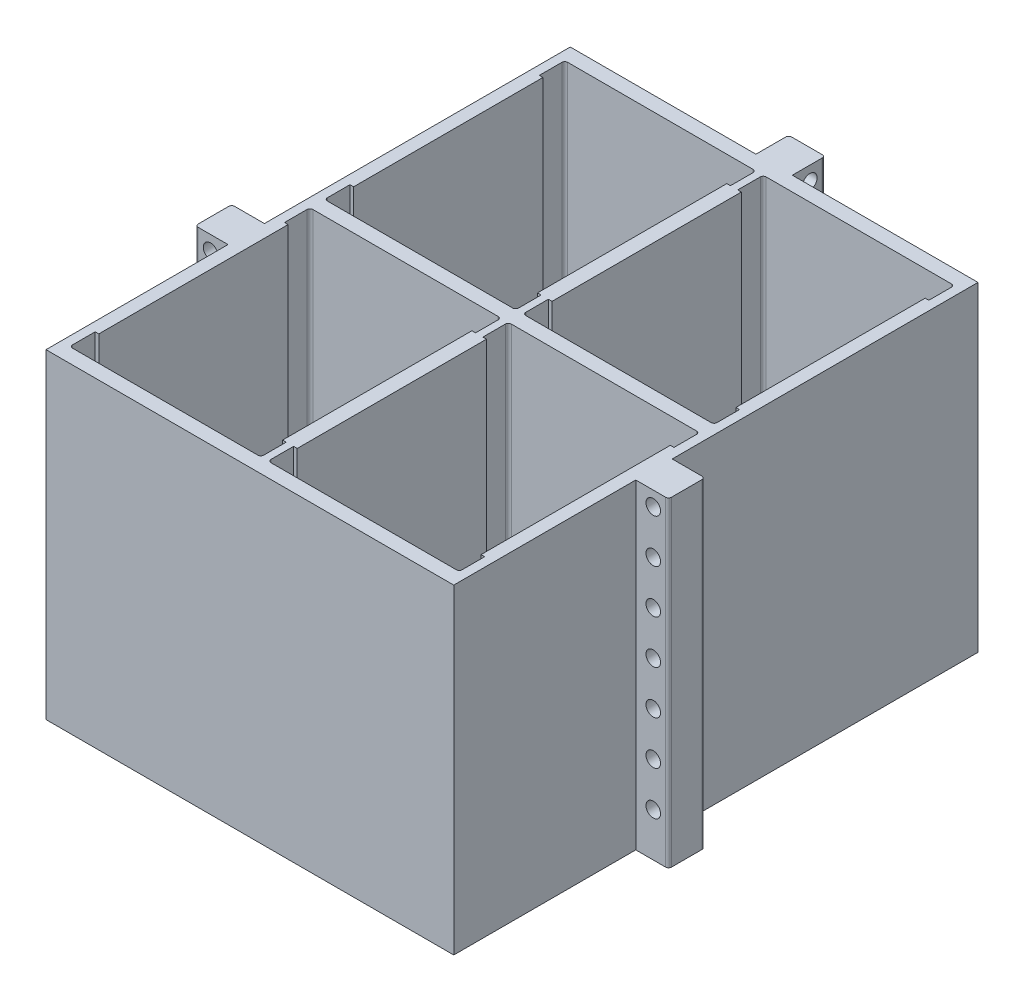
from build123d import *

# Parameters (mm, degrees)
BOSS_EXTRUDE1_DEPTH = 279.4
SKETCH2_R           = 6.35
CUT_EXTRUDE1_DEPTH  = 45.72
SKETCH3_R           = 6.35
CUT_EXTRUDE2_DEPTH  = 45.72
FILLET1_R           = 2.54
CUT_EXTRUDE3_DEPTH  = 274.32
FILLET2_R           = 2.54


with BuildPart() as part:
    # Sketch1 → Boss-Extrude1 (new body)
    with BuildSketch(Plane(origin=(0, 0, 0), x_dir=(1, 0, 0), z_dir=(0, 1, 0))):
        Polygon((-177.8, -228.6), (-31.75, -228.6), (31.75, -228.6), (177.8, -228.6), (177.8, -69.85), (206.375, -69.85), (206.375, -38.1), (177.8, -38.1), (177.8, 228.6), (15.875, 228.6), (15.875, 257.175), (-15.875, 257.175), (-15.875, 228.6), (-177.8, 228.6), (-177.8, -38.1), (-206.375, -38.1), (-206.375, -69.85), (-177.8, -69.85), align=None)
    extrude(amount=BOSS_EXTRUDE1_DEPTH)

    # Sketch2 → Cut-Extrude1 (cut)
    with BuildSketch(Plane.XY.offset(69.85)):
        with Locations((-193.04, 38.1)):
            Circle(SKETCH2_R)
        with Locations((-193.04, 76.2)):
            Circle(SKETCH2_R)
        with Locations((-193.04, 114.3)):
            Circle(SKETCH2_R)
        with Locations((-193.04, 152.4)):
            Circle(SKETCH2_R)
        with Locations((-193.04, 190.5)):
            Circle(SKETCH2_R)
        with Locations((-193.04, 228.6)):
            Circle(SKETCH2_R)
        with Locations((-193.04, 266.7)):
            Circle(SKETCH2_R)
        with Locations((193.04, 266.7)):
            Circle(SKETCH2_R)
        with Locations((193.04, 228.6)):
            Circle(SKETCH2_R)
        with Locations((193.04, 190.5)):
            Circle(SKETCH2_R)
        with Locations((193.04, 152.4)):
            Circle(SKETCH2_R)
        with Locations((193.04, 114.3)):
            Circle(SKETCH2_R)
        with Locations((193.04, 76.2)):
            Circle(SKETCH2_R)
        with Locations((193.04, 38.1)):
            Circle(SKETCH2_R)
    extrude(amount=-CUT_EXTRUDE1_DEPTH, mode=Mode.SUBTRACT)

    # Sketch3 → Cut-Extrude2 (cut)
    with BuildSketch(Plane.ZY.offset(15.875)):
        with Locations((-243.84, 38.1)):
            Circle(SKETCH3_R)
        with Locations((-243.84, 76.2)):
            Circle(SKETCH3_R)
        with Locations((-243.84, 114.3)):
            Circle(SKETCH3_R)
        with Locations((-243.84, 152.4)):
            Circle(SKETCH3_R)
        with Locations((-243.84, 190.5)):
            Circle(SKETCH3_R)
        with Locations((-243.84, 228.6)):
            Circle(SKETCH3_R)
        with Locations((-243.84, 266.7)):
            Circle(SKETCH3_R)
    extrude(amount=-CUT_EXTRUDE2_DEPTH, mode=Mode.SUBTRACT)

    # Fillet1
    fillet1_edges = [part.edges().sort_by_distance(p)[0] for p in [
        (206.375, 139.7, 69.85),
        (206.375, 139.7, 38.1),
        (15.875, 139.7, -257.175),
        (-15.875, 139.7, -257.175),
        (-206.375, 139.7, 69.85),
        (-206.375, 139.7, 38.1),
    ]]
    fillet(fillet1_edges, radius=FILLET1_R)

    # Sketch4 → Cut-Extrude3 (cut)
    with BuildSketch(Plane(origin=(0, 279.4, 0), x_dir=(1, 0, 0), z_dir=(0, 1, 0))):
        Polygon((-3.175, 215.9), (-169.8625, 215.9), (-169.8625, 193.675), (-166.6875, 193.675), (-166.6875, 28.575), (-169.8625, 28.575), (-169.8625, 6.35), (-3.175, 6.35), (-3.175, 28.575), (-6.35, 28.575), (-6.35, 193.675), (-3.175, 193.675), align=None)
        Polygon((3.175, 28.575), (6.35, 28.575), (6.35, 193.675), (3.175, 193.675), (3.175, 215.9), (169.8625, 215.9), (169.8625, 193.675), (166.6875, 193.675), (166.6875, 28.575), (169.8625, 28.575), (169.8625, 6.35), (3.175, 6.35), align=None)
        Polygon((3.175, -193.675), (3.175, -215.9), (169.8625, -215.9), (169.8625, -193.675), (166.6875, -193.675), (166.6875, -28.575), (169.8625, -28.575), (169.8625, -6.35), (3.175, -6.35), (3.175, -28.575), (6.35, -28.575), (6.35, -193.675), align=None)
        Polygon((-3.175, -193.675), (-3.175, -215.9), (-169.8625, -215.9), (-169.8625, -193.675), (-166.6875, -193.675), (-166.6875, -28.575), (-169.8625, -28.575), (-169.8625, -6.35), (-3.175, -6.35), (-3.175, -28.575), (-6.35, -28.575), (-6.35, -193.675), align=None)
    extrude(amount=-CUT_EXTRUDE3_DEPTH, mode=Mode.SUBTRACT)

    # Fillet2
    fillet2_edges = [part.edges().sort_by_distance(p)[0] for p in [
        (169.8625, 142.24, 215.9),
        (-3.175, 142.24, 215.9),
        (-169.8625, 142.24, 215.9),
        (3.175, 142.24, 215.9),
        (169.8625, 142.24, 6.35),
        (-3.175, 142.24, 6.35),
        (-169.8625, 142.24, 6.35),
        (3.175, 142.24, 6.35),
        (-3.175, 142.24, -6.35),
        (-169.8625, 142.24, -6.35),
        (-3.175, 142.24, -215.9),
        (-169.8625, 142.24, -215.9),
        (3.175, 142.24, -215.9),
        (169.8625, 142.24, -215.9),
        (169.8625, 142.24, -6.35),
        (3.175, 142.24, -6.35),
    ]]
    fillet(fillet2_edges, radius=FILLET2_R)


solid = part.part
